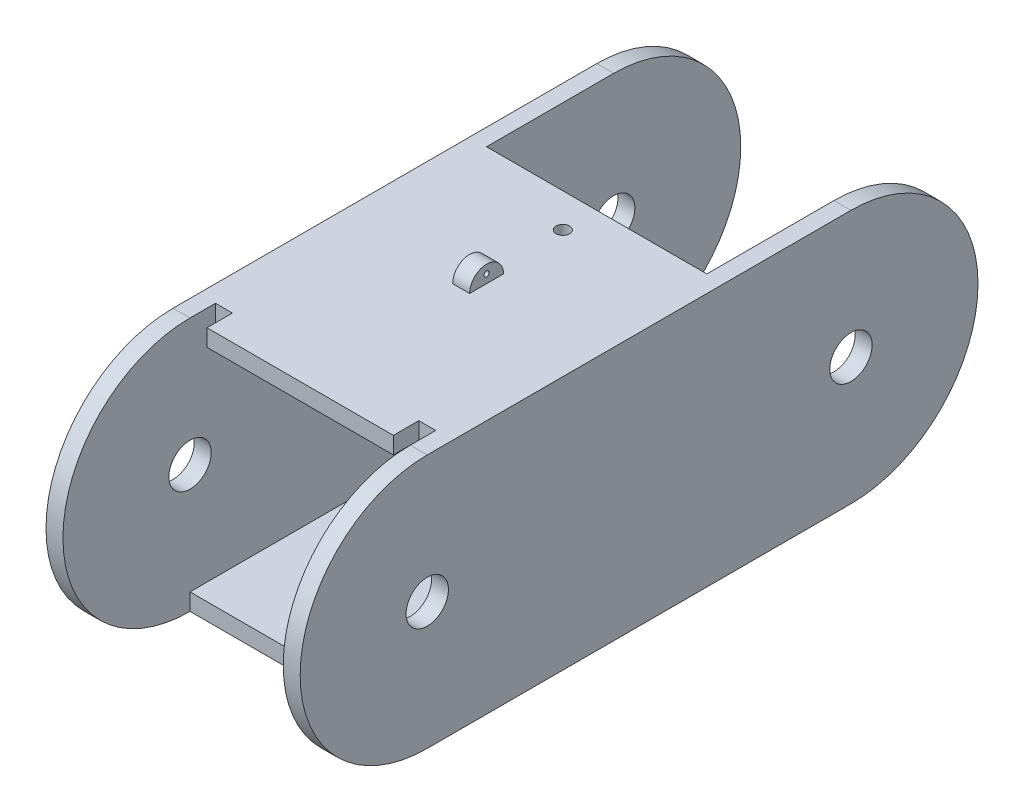
from build123d import *

# Parameters (mm, degrees)
SKETCH1_W           = 19.05
SKETCH1_H           = 50.8
BOSS_EXTRUDE1_DEPTH = 19.05
SKETCH2_W           = 16.51
SKETCH2_H           = 16.51
CUT_EXTRUDE1_DEPTH  = 50.8
SKETCH3_W           = 1.27
SKETCH3_H           = 2.54
BOSS_EXTRUDE2_DEPTH = 1.27
SKETCH4_R           = 0.1905
SKETCH4_R_2         = 1.5875
CUT_EXTRUDE2_DEPTH  = 19.05
SKETCH7_R           = 0.508
CUT_EXTRUDE3_DEPTH  = 12.7
SKETCH8_W           = 16.51
SKETCH8_H           = 5.490944517
CUT_EXTRUDE4_DEPTH  = 25.4
SKETCH11_W          = 16.51
SKETCH11_H          = 14.276904881
CUT_EXTRUDE6_DEPTH  = 2.54
SKETCH12_W          = 16.51
SKETCH12_H          = 4.751904881
CUT_EXTRUDE7_DEPTH  = 2.54


with BuildPart() as part:
    # Sketch1 → Boss-Extrude1 (new body)
    with BuildSketch(Plane(origin=(0, 0, 0), x_dir=(1, 0, 0), z_dir=(0, 1, 0))):
        with Locations((9.525, 25.4)):
            Rectangle(SKETCH1_W, SKETCH1_H)
    extrude(amount=BOSS_EXTRUDE1_DEPTH)

    # Sketch2 → Cut-Extrude1 (cut)
    with BuildSketch(Plane.XY):
        with Locations((9.525, 9.525)):
            Rectangle(SKETCH2_W, SKETCH2_H)
    extrude(amount=-CUT_EXTRUDE1_DEPTH, mode=Mode.SUBTRACT)

    # Sketch3 → Boss-Extrude2 (add)
    with BuildSketch(Plane(origin=(0, 19.05, 0), x_dir=(1, 0, 0), z_dir=(0, 1, 0))):
        with Locations((9.525, 22.86)):
            Rectangle(SKETCH3_W, SKETCH3_H)
    extrude(amount=BOSS_EXTRUDE2_DEPTH)

    # Sketch4 → Cut-Extrude2 (cut)
    with BuildSketch(Plane(origin=(0, 0, 0), x_dir=(0, 0, -1), z_dir=(1, 0, 0))):
        with Locations((22.86, 19.685)):
            Circle(SKETCH4_R)
        with Locations((9.525, 9.525)):
            Circle(SKETCH4_R_2)
        with BuildLine():
            ThreePointArc((24.13, 19.05), (22.86, 22.337330126), (21.59, 19.05))
            add(Edge.make_bspline(
                [(24.13, 19.05), (24.13, 20.32), (22.86, 20.32), (21.59, 20.32), (21.59, 19.05)],
                knots=[3.141592654, 3.141592654, 3.141592654, 4.71238898, 4.71238898, 6.283185307, 6.283185307, 6.283185307], degree=2, weights=[1, 0.707106781, 1, 0.707106781, 1]))
        make_face()
        with BuildLine():
            ThreePointArc((9.525, 19.05), (0, 9.525), (9.525, 0))
            ThreePointArc((9.525, 0), (-29.420443119, 9.525), (9.525, 19.05))
        make_face()
    cut_extrude2 = extrude(amount=CUT_EXTRUDE2_DEPTH, mode=Mode.SUBTRACT)

    # Mirror1: Cut-Extrude2 across plane
    add(cut_extrude2.mirror(Plane.XY.offset(-25.4)), mode=Mode.SUBTRACT)

    # Sketch7 → Cut-Extrude3 (cut)
    with BuildSketch(Plane(origin=(0, 19.05, 0), x_dir=(1, 0, 0), z_dir=(0, 1, 0))):
        with Locations((9.525, 29.21)):
            Circle(SKETCH7_R)
        Polygon((2.54, 9.525), (16.51, 9.525), (16.51, 11.43), (17.78, 11.43), (17.78, 0), (16.51, 0), (2.54, 0), (1.27, 0), (1.27, 11.43), (2.54, 11.43), align=None)
    extrude(amount=-CUT_EXTRUDE3_DEPTH, mode=Mode.SUBTRACT)

    # Sketch8 → Cut-Extrude4 (cut)
    with BuildSketch(Plane(origin=(0, 19.05, 0), x_dir=(1, 0, 0), z_dir=(0, 1, 0))):
        with Locations((9.525, 6.779527742)):
            Rectangle(SKETCH8_W, SKETCH8_H)
    extrude(amount=-CUT_EXTRUDE4_DEPTH, mode=Mode.SUBTRACT)

    # Sketch11 → Cut-Extrude6 (cut)
    with BuildSketch(Plane(origin=(0, 19.05, 0), x_dir=(1, 0, 0), z_dir=(0, 1, 0))):
        with Locations((9.525, 38.888452441)):
            Rectangle(SKETCH11_W, SKETCH11_H)
    extrude(amount=-CUT_EXTRUDE6_DEPTH, mode=Mode.SUBTRACT)

    # Sketch12 → Cut-Extrude7 (cut)
    with BuildSketch(Plane(origin=(0, 0, 0), x_dir=(1, 0, 0), z_dir=(0, 1, 0))):
        with Locations((9.525, 43.650952441)):
            Rectangle(SKETCH12_W, SKETCH12_H)
    extrude(amount=CUT_EXTRUDE7_DEPTH, mode=Mode.SUBTRACT)


solid = part.part
